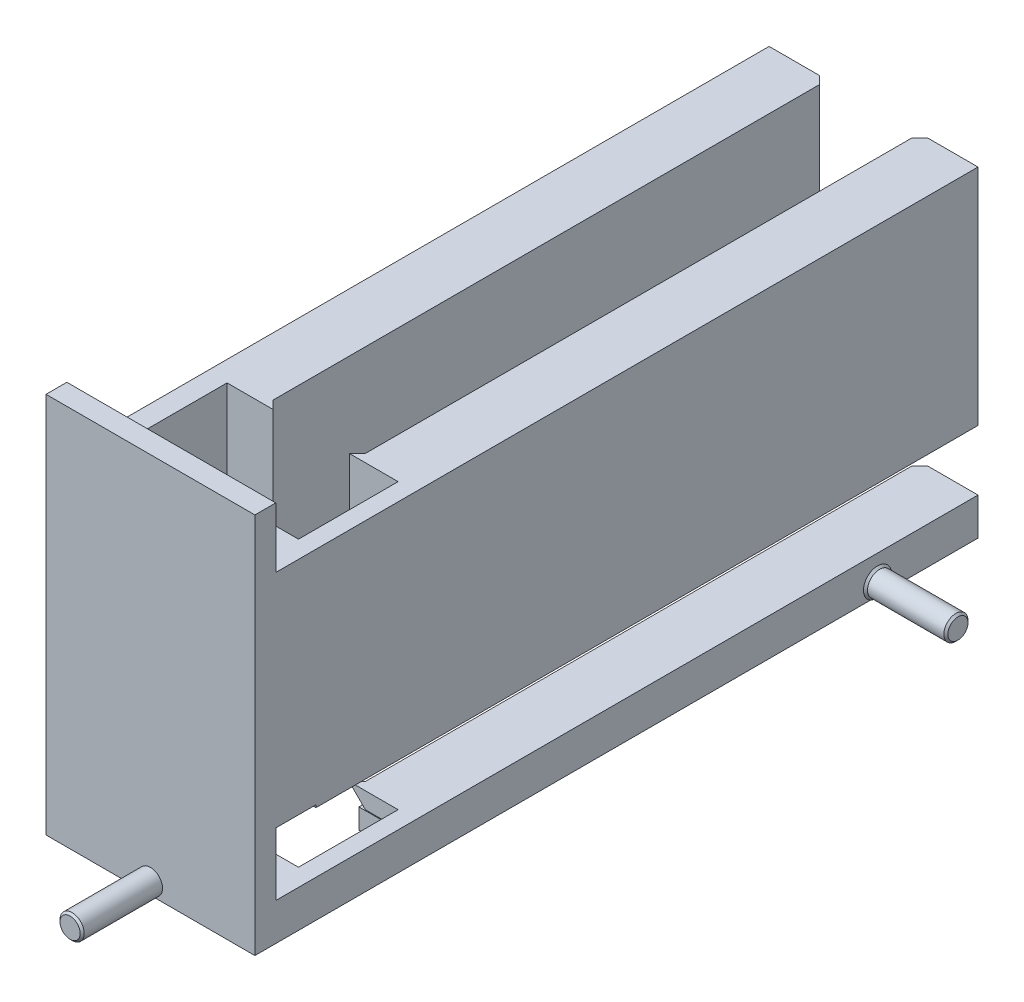
from build123d import *

# Parameters (mm, degrees)
SKETCH_1_W           = 52
SKETCH_1_H           = 95
EXTRUDE_1_DEPTH      = 180
SKETCH_2_W           = 23
SKETCH_2_H           = 90
CUT_EXTRUDE_1_DEPTH  = 140
SKETCH_3_W           = 9.5
SKETCH_3_H           = 2.2
CUT_EXTRUDE_2_DEPTH  = 140
CHAMFER_1_SIZE       = 2
CUT_EXTRUDE_3_DEPTH  = 140
SKETCH_5_W           = 140
SKETCH_5_H           = 15
CUT_EXTRUDE_4_DEPTH  = 140
SKETCH_6_W           = 140
SKETCH_6_H           = 15
CUT_EXTRUDE_7_DEPTH  = 140
CUT_EXTRUDE_8_DEPTH  = 140
SKETCH_8_W           = 24.808453611
SKETCH_8_H           = 15
CUT_EXTRUDE_9_DEPTH  = 140
SKETCH_9_W           = 10
SKETCH_9_H           = 14.176065277
SKETCH_9_H_2         = 15.630765607
CUT_EXTRUDE_10_DEPTH = 140
SKETCH_10_W          = 52
SKETCH_10_H          = 0.823934723
CUT_EXTRUDE_11_DEPTH = 10
SKETCH_12_R          = 3.01
EXTRUDE_2_DEPTH      = 20
CHAMFER_3_SIZE       = 0.5
SKETCH_13_R          = 3.01
EXTRUDE_4_DEPTH      = 20
CHAMFER_4_SIZE       = 0.5
EXTRUDE_START        = 20
SKETCH_15_R          = 3.01
EXTRUDE_5_DEPTH      = 20
CHAMFER_5_SIZE       = 0.5


with BuildPart() as part:
    # 草图1 → 凸台-拉伸1 (new body)
    with BuildSketch(Plane.XY):
        with Locations((0, 47.5)):
            Rectangle(SKETCH_1_W, SKETCH_1_H)
    extrude(amount=EXTRUDE_1_DEPTH)

    # 草图2 → 切除-拉伸1 (cut)
    with BuildSketch(Plane(origin=(0, 0, 0), x_dir=(-1, 0, 0), z_dir=(0, 0, -1))):
        with Locations((0, 50)):
            Rectangle(SKETCH_2_W, SKETCH_2_H)
    extrude(amount=-CUT_EXTRUDE_1_DEPTH, mode=Mode.SUBTRACT)

    # 草图3 → 切除-拉伸2 (cut)
    with BuildSketch(Plane(origin=(0, 0, 0), x_dir=(-1, 0, 0), z_dir=(0, 0, -1))):
        with Locations((-16.25, 6.1)):
            Rectangle(SKETCH_3_W, SKETCH_3_H)
        with Locations((16.25, 6.1)):
            Rectangle(SKETCH_3_W, SKETCH_3_H)
    extrude(amount=-CUT_EXTRUDE_2_DEPTH, mode=Mode.SUBTRACT)

    # 倒角1
    chamfer_1_edges = [part.edges().sort_by_distance(p)[0] for p in [
        (11.5, 51.1, 140),
        (0, 95, 140),
        (11.5, 95, 70),
        (-11.5, 95, 70),
        (11.5, 51.1, 0),
        (-11.5, 51.1, 140),
        (-11.5, 51.1, 0),
        (11.5, 7.2, 70),
        (16.25, 7.2, 140),
        (-16.25, 7.2, 140),
        (-11.5, 7.2, 70),
    ]]
    chamfer(chamfer_1_edges, length=CHAMFER_1_SIZE)

    # 草图4 → 切除-拉伸3 (cut)
    with BuildSketch(Plane(origin=(0, 0, 0), x_dir=(-1, 0, 0), z_dir=(0, 0, -1))):
        Polygon((-0.565514489, 0), (0, 0), (12.126296858, 0), (12.126296858, 5), (-11.873703142, 5), (-11.873703142, 0), align=None)
    extrude(amount=-CUT_EXTRUDE_3_DEPTH, mode=Mode.SUBTRACT)

    # 草图5 → 切除-拉伸4 (cut)
    with BuildSketch(Plane(origin=(26, 0, 0), x_dir=(0, 0, -1), z_dir=(1, 0, 0))):
        with Locations((-70, 87.5)):
            Rectangle(SKETCH_5_W, SKETCH_5_H)
    extrude(amount=-CUT_EXTRUDE_4_DEPTH, mode=Mode.SUBTRACT)

    # 草图6 → 切除-拉伸7 (cut)
    with BuildSketch(Plane(origin=(26, 0, 0), x_dir=(0, 0, -1), z_dir=(1, 0, 0))):
        with Locations((-70, 16.784197303)):
            Rectangle(SKETCH_6_W, SKETCH_6_H)
    extrude(amount=-CUT_EXTRUDE_7_DEPTH, mode=Mode.SUBTRACT)

    # 草图7 → 切除-拉伸8 (cut)
    with BuildSketch(Plane(origin=(0, 95, 0), x_dir=(1, 0, 0), z_dir=(0, 1, 0))):
        Polygon((0, -140), (21.6540992, -140), (21.6540992, -164.808453611), (-20.3459008, -164.808453611), (-20.926391083, -164.808453611), (-20.926391083, -140), align=None)
    extrude(amount=-CUT_EXTRUDE_8_DEPTH, mode=Mode.SUBTRACT)

    # 草图8 → 切除-拉伸9 (cut)
    with BuildSketch(Plane(origin=(26, 0, 0), x_dir=(0, 0, -1), z_dir=(1, 0, 0))):
        with Locations((-152.404226806, 87.5)):
            Rectangle(SKETCH_8_W, SKETCH_8_H)
        with Locations((-152.404226806, 16.784197303)):
            Rectangle(SKETCH_8_W, SKETCH_8_H)
    extrude(amount=-CUT_EXTRUDE_9_DEPTH, mode=Mode.SUBTRACT)

    # 草图9 → 切除-拉伸10 (cut)
    with BuildSketch(Plane(origin=(26, 0, 0), x_dir=(0, 0, -1), z_dir=(1, 0, 0))):
        with Locations((-169.808453611, 87.911967362)):
            Rectangle(SKETCH_9_W, SKETCH_9_H)
        with Locations((-169.808453611, 17.099580106)):
            Rectangle(SKETCH_9_W, SKETCH_9_H_2)
    extrude(amount=-CUT_EXTRUDE_10_DEPTH, mode=Mode.SUBTRACT)

    # 草图10 → 切除-拉伸11 (cut)
    with BuildSketch(Plane(origin=(0, 0, 164.808453611), x_dir=(-1, 0, 0), z_dir=(0, 0, -1))):
        with Locations((0, 80.411967362)):
            Rectangle(SKETCH_10_W, SKETCH_10_H)
    extrude(amount=-CUT_EXTRUDE_11_DEPTH, mode=Mode.SUBTRACT)

    # 草图12 → 凸台-拉伸2 (add)
    with BuildSketch(Plane.XY.offset(180)):
        with Locations(Location((0, 3.01, 0), (0, 0, 270))):
            Circle(SKETCH_12_R)
    extrude(amount=EXTRUDE_2_DEPTH)

    # 倒角3
    chamfer_3_edges = [part.edges().sort_by_distance(p)[0] for p in [
        (0, 6.02, 200),
    ]]
    chamfer(chamfer_3_edges, length=CHAMFER_3_SIZE)

    # 草图13 → 凸台-拉伸4 (add)
    with BuildSketch(Plane(origin=(26, 0, 0), x_dir=(0, 0, -1), z_dir=(1, 0, 0))):
        with Locations(Location((-25, 3.01, 0), (0, 0, 270))):
            Circle(SKETCH_13_R)
    extrude(amount=EXTRUDE_4_DEPTH)

    # 倒角4
    # the kernel refuses this chamfer: 0.5 mm, written as the material it adds along each edge
    with BuildSketch(Plane(origin=(26, 3.01, 25), x_dir=(0, -1, 0), z_dir=(0, 0, 1))) as chamfer_4_piece_1_section:
        Polygon((3.01 + CHAMFER_4_SIZE, 0), (3.01, CHAMFER_4_SIZE), (3.01, 0), align=None)
    chamfer_4_piece_1 = revolve(axis=Axis((26, 3.01, 25), (1, 0, 0)), mode=Mode.PRIVATE)
    chamfer_4_piece_1 = split(chamfer_4_piece_1, bisect_by=Plane(origin=(26.240420809, 0, 25), z_dir=(0, 1, 0)), keep=Keep.TOP, mode=Mode.PRIVATE)
    add(chamfer_4_piece_1)
    # the kernel refuses this chamfer: 0.5 mm, written as the material it takes off along each edge
    with BuildSketch(Plane(origin=(46, 3.01, 25), x_dir=(0, -1, 0), z_dir=(0, 0, 1))) as chamfer_4_2_piece_1:
        Polygon((3.01, -CHAMFER_4_SIZE), (3.01 - CHAMFER_4_SIZE, 0), (3.01, 0), align=None)
    revolve(axis=Axis((46, 3.01, 25), (1, 0, 0)), mode=Mode.SUBTRACT)

    # 草图15 → 凸台-拉伸5 (add)
    with BuildSketch(Plane.ZY.offset(26).offset(EXTRUDE_START)):
        with Locations(Location((25, 3.01, 0), (0, 0, 270))):
            Circle(SKETCH_15_R)
    extrude(amount=-EXTRUDE_5_DEPTH)

    # 倒角5
    # the kernel refuses this chamfer: 0.5 mm, written as the material it adds along each edge
    with BuildSketch(Plane(origin=(-26, 3.01, 25), x_dir=(0, -1, 0), z_dir=(0, 0, -1))) as chamfer_5_piece_1_section:
        Polygon((3.01 + CHAMFER_5_SIZE, 0), (3.01, CHAMFER_5_SIZE), (3.01, 0), align=None)
    chamfer_5_piece_1 = revolve(axis=Axis((-26, 3.01, 25), (-1, 0, 0)), mode=Mode.PRIVATE)
    chamfer_5_piece_1 = split(chamfer_5_piece_1, bisect_by=Plane(origin=(-26.240420809, 0, 25), z_dir=(0, 1, 0)), keep=Keep.TOP, mode=Mode.PRIVATE)
    add(chamfer_5_piece_1)
    # the kernel refuses this chamfer: 0.5 mm, written as the material it takes off along each edge
    with BuildSketch(Plane(origin=(-46, 3.01, 25), x_dir=(0, -1, 0), z_dir=(0, 0, -1))) as chamfer_5_2_piece_1:
        Polygon((3.01, -CHAMFER_5_SIZE), (3.01 - CHAMFER_5_SIZE, 0), (3.01, 0), align=None)
    revolve(axis=Axis((-46, 3.01, 25), (-1, 0, 0)), mode=Mode.SUBTRACT)


solid = part.part
